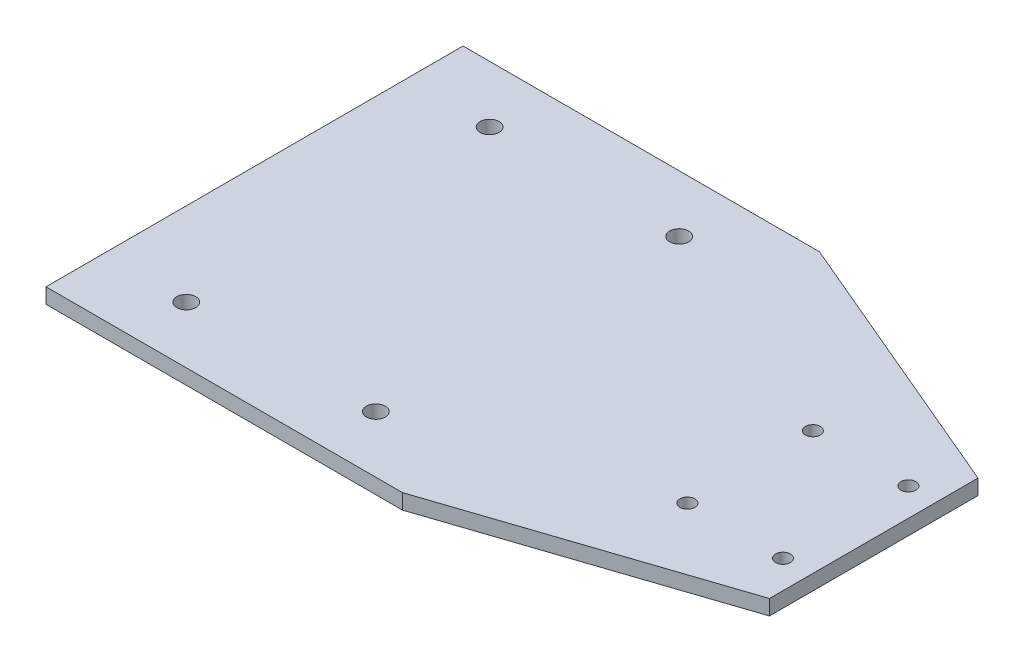
from build123d import *

# Parameters (mm, degrees)
SKETCH1_R           = 1.5875
SKETCH1_R_2         = 1.25
BOSS_EXTRUDE1_DEPTH = 2.54


with BuildPart() as part:
    # Sketch1 → Boss-Extrude1 (new body)
    with BuildSketch(Plane(origin=(0, 0, 0), x_dir=(1, 0, 0), z_dir=(0, 1, 0))):
        Polygon((75.945, 15.376423832), (29.845, 34.925), (-29.845, 34.925), (-29.845, -34.925), (29.845, -34.925), (75.945, -19.548576168), align=None)
        with Locations((-15.875, 25.4)):
            Circle(SKETCH1_R, mode=Mode.SUBTRACT)
        with Locations((15.875, 25.4)):
            Circle(SKETCH1_R, mode=Mode.SUBTRACT)
        with Locations((15.875, -25.4)):
            Circle(SKETCH1_R, mode=Mode.SUBTRACT)
        with Locations((-15.875, -25.4)):
            Circle(SKETCH1_R, mode=Mode.SUBTRACT)
        with Locations((71.245, 8.413923832)):
            Circle(SKETCH1_R_2, mode=Mode.SUBTRACT)
        with Locations((71.245, -12.586076168)):
            Circle(SKETCH1_R_2, mode=Mode.SUBTRACT)
        with Locations((55.245, -12.586076168)):
            Circle(SKETCH1_R_2, mode=Mode.SUBTRACT)
        with Locations((55.245, 8.413923832)):
            Circle(SKETCH1_R_2, mode=Mode.SUBTRACT)
    extrude(amount=BOSS_EXTRUDE1_DEPTH)


solid = part.part
